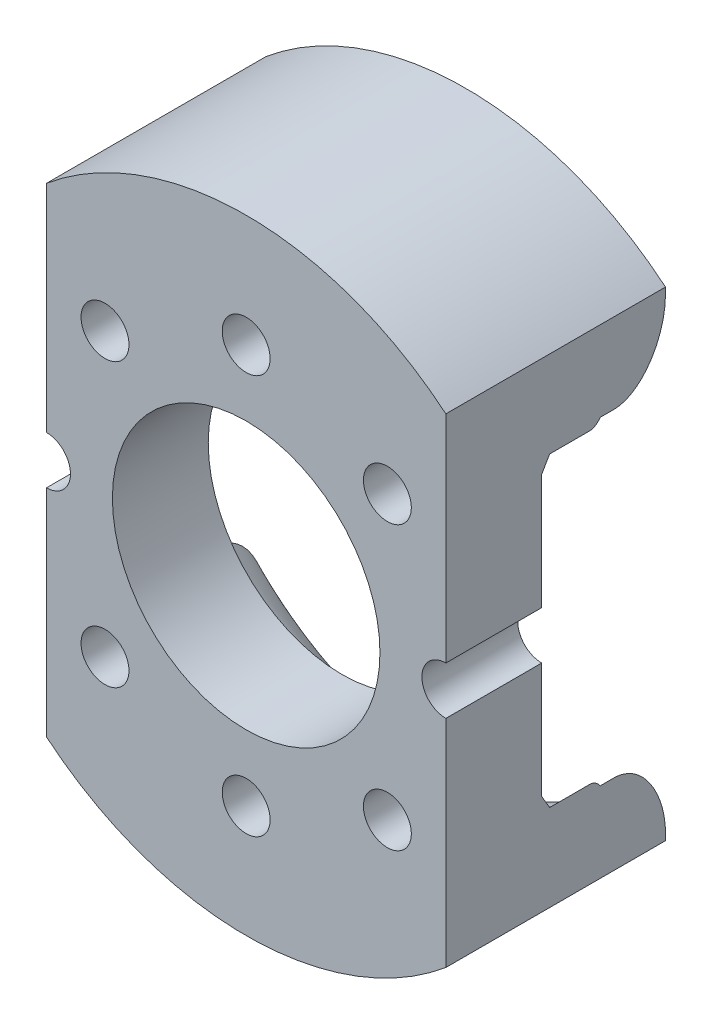
from build123d import *

# Parameters (mm, degrees)
BOSS_EXTRUDE1_OUTLINE_R     = 39.0639683
BOSS_EXTRUDE1_OUTLINE_R_2   = 3
BOSS_EXTRUDE1_OUTLINE_R_3   = 16.75
BOSS_EXTRUDE1_DEPTH         = 12
BOSS_EXTRUDE1_START         = -9.0000001
BOSS_EXTRUDE1_2_OUTLINE_R   = 39.0639683
BOSS_EXTRUDE1_2_OUTLINE_R_2 = 32
BOSS_EXTRUDE1_2_DEPTH       = 9.0000001
BOSS_EXTRUDE1_START_2       = -6.0000001
BOSS_EXTRUDE1_3_OUTLINE_R   = 32
BOSS_EXTRUDE1_3_OUTLINE_R_2 = 31.5
BOSS_EXTRUDE1_3_DEPTH       = 6.0000001
CUT_EXTRUDE1_REACH          = 63.711


with BuildPart() as part:
    # Boss-Extrude1: read off the stored shape, not the designer's step
    # Boss-Extrude1 outline → Boss-Extrude1 (new body)
    with BuildSketch(Plane.XY):
        Circle(BOSS_EXTRUDE1_OUTLINE_R)
        with Locations((0, 25)):
            Circle(BOSS_EXTRUDE1_OUTLINE_R_2, mode=Mode.SUBTRACT)
        with Locations((-17.67766953, -17.67766953)):
            Circle(BOSS_EXTRUDE1_OUTLINE_R_2, mode=Mode.SUBTRACT)
        with Locations((0, -25)):
            Circle(BOSS_EXTRUDE1_OUTLINE_R_2, mode=Mode.SUBTRACT)
        with Locations((17.67766953, -17.67766953)):
            Circle(BOSS_EXTRUDE1_OUTLINE_R_2, mode=Mode.SUBTRACT)
        with Locations((-25, 0)):
            Circle(BOSS_EXTRUDE1_OUTLINE_R_2, mode=Mode.SUBTRACT)
        with Locations((-17.67766953, 17.67766953)):
            Circle(BOSS_EXTRUDE1_OUTLINE_R_2, mode=Mode.SUBTRACT)
        Circle(BOSS_EXTRUDE1_OUTLINE_R_3, mode=Mode.SUBTRACT)
        with Locations((17.67766953, 17.67766953)):
            Circle(BOSS_EXTRUDE1_OUTLINE_R_2, mode=Mode.SUBTRACT)
        with Locations((25, 0)):
            Circle(BOSS_EXTRUDE1_OUTLINE_R_2, mode=Mode.SUBTRACT)
    extrude(amount=BOSS_EXTRUDE1_DEPTH)



with BuildPart() as body_2:
    # Boss-Extrude1 2 outline → Boss-Extrude1 2 (new body)
    with BuildSketch(Plane.XY.offset(BOSS_EXTRUDE1_START)):
        Circle(BOSS_EXTRUDE1_2_OUTLINE_R)
        Circle(BOSS_EXTRUDE1_2_OUTLINE_R_2, mode=Mode.SUBTRACT)
    extrude(amount=BOSS_EXTRUDE1_2_DEPTH)


with BuildPart() as body_3:
    # Boss-Extrude1 3 outline → Boss-Extrude1 3 (new body)
    with BuildSketch(Plane.XY.offset(BOSS_EXTRUDE1_START_2)):
        Circle(BOSS_EXTRUDE1_3_OUTLINE_R)
        Circle(BOSS_EXTRUDE1_3_OUTLINE_R_2, mode=Mode.SUBTRACT)
    extrude(amount=BOSS_EXTRUDE1_3_DEPTH)


with BuildPart() as part_1:
    add(part.part)

    add(body_2.part)  # Boss-Extrude1 4 merges body 2

    add(body_3.part)  # Boss-Extrude1 4 merges body 3
    # Boss-Extrude1 4 outline → Boss-Extrude1 4 (revolve)
    with BuildSketch(Plane.XZ):
        Polygon((31.499999999, -1.000000001), (31.499999999, 0), (30.5, 0), align=None)
        with BuildLine():
            Line((32, -7.322875656), (32, -6.0000001))
            Line((32, -6.0000001), (31.5, -6))
            ThreePointArc((31.5, -6), (31.629171307, -6.707106781), (32, -7.322875656))
        make_face()
        with BuildLine():
            Line((39.0639683, -15.5), (39.0639683, -9.0000001))
            Line((39.0639683, -9.0000001), (32, -9))
            ThreePointArc((32, -9), (33.903805922, -13.596194078), (38.5, -15.5))
            Line((38.5, -15.5), (39.0639683, -15.5))
        make_face()
    revolve(axis=Axis((0, 0, 0), (0, 0, 1)))

    # Sketch2 → Cut-Extrude1 (cut, up to next)
    with BuildSketch(Plane.XY.offset(12), mode=Mode.PRIVATE) as cut_extrude1_sk1:
        with BuildLine():
            Line((-25, -30.016555754), (-25, 30.016555754))
            ThreePointArc((-25, 30.016555754), (-39.0639683, 0), (-25, -30.016555754))
        make_face()
    cut_extrude1_tool1 = extrude(cut_extrude1_sk1.sketch, amount=-CUT_EXTRUDE1_REACH, mode=Mode.PRIVATE) & part_1.part
    # Sketch2 → Cut-Extrude1 (cut, up to next)
    with BuildSketch(Plane.XY.offset(12), mode=Mode.PRIVATE) as cut_extrude1_sk2:
        with BuildLine():
            Line((25, -30.016555754), (25, 30.016555754))
            ThreePointArc((25, 30.016555754), (39.0639683, 0), (25, -30.016555754))
        make_face()
    cut_extrude1_tool2 = extrude(cut_extrude1_sk2.sketch, amount=-CUT_EXTRUDE1_REACH, mode=Mode.PRIVATE) & part_1.part
    add(cut_extrude1_tool1.solids().sort_by_distance((-30.722563, 0, 12))[0], mode=Mode.SUBTRACT)
    add(cut_extrude1_tool2.solids().sort_by_distance((30.722563, 0, 12))[0], mode=Mode.SUBTRACT)


solid = part_1.part
